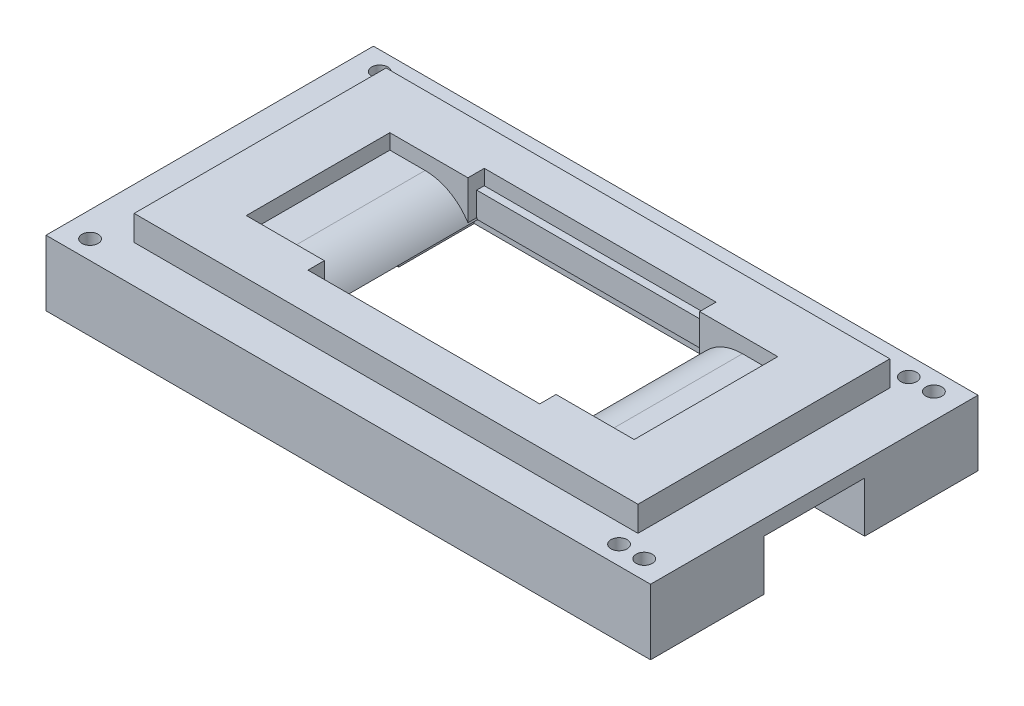
from build123d import *

# Parameters (mm, degrees)
BOSS_EXTRUDE3_DEPTH = 2
SKETCH1_6_W         = 100
SKETCH1_6_H         = 50
BOSS_EXTRUDE4_DEPTH = 5
SKETCH2_W           = 120
SKETCH2_H           = 65
SKETCH2_R           = 1.6
BOSS_EXTRUDE5_DEPTH = 13
SKETCH2_2_W         = 120
SKETCH2_2_H         = 65
SKETCH2_2_R         = 1.6
BOSS_EXTRUDE6_DEPTH = 3
CUT_EXTRUDE1_REACH  = 71.866
SKETCH7_W           = 43
SKETCH7_H           = 32
FILLET1_R           = 10
SKETCH8_W           = 38.5
SKETCH8_H           = 20
CUT_EXTRUDE2_DEPTH  = 10
SKETCH9_W           = 65
SKETCH9_H           = 50
CUT_EXTRUDE3_DEPTH  = 10


with BuildPart() as part:
    # Sketch1 → Boss-Extrude3 (new body)
    with BuildSketch(Plane(origin=(0, 0, 0), x_dir=(1, 0, 0), z_dir=(0, 1, 0))):
        Polygon((23, -14.25), (23, -17.5), (-23, -17.5), (-23, -14.25), (-38.5, -14.25), (-38.5, 14.25), (-23, 14.25), (-23, 17.5), (23, 17.5), (23, 14.25), (38.5, 14.25), (38.5, -14.25), align=None)
    extrude(amount=BOSS_EXTRUDE3_DEPTH)

    # Sketch1<6> → Boss-Extrude4 (add)
    with BuildSketch(Plane(origin=(0, 0, 0), x_dir=(1, 0, 0), z_dir=(0, 1, 0))):
        Rectangle(SKETCH1_6_W, SKETCH1_6_H)
        Polygon((23, -14.25), (23, -17.5), (-23, -17.5), (-23, -14.25), (-38.5, -14.25), (-38.5, 14.25), (-23, 14.25), (-23, 17.5), (23, 17.5), (23, 14.25), (38.5, 14.25), (38.5, -14.25), align=None, mode=Mode.SUBTRACT)
    extrude(amount=BOSS_EXTRUDE4_DEPTH)

    # Sketch2 → Boss-Extrude5 (add)
    with BuildSketch(Plane.XZ):
        Rectangle(SKETCH2_W, SKETCH2_H)
        with Locations(Location((-55, 28.75, 0), (0, 0, 90))):
            Circle(SKETCH2_R, mode=Mode.SUBTRACT)
        with Locations(Location((55, 28.75, 0), (0, 0, 90))):
            Circle(SKETCH2_R, mode=Mode.SUBTRACT)
        with Locations(Location((55, -28.75, 0), (0, 0, 90))):
            Circle(SKETCH2_R, mode=Mode.SUBTRACT)
        with Locations(Location((-55, -28.75, 0), (0, 0, 90))):
            Circle(SKETCH2_R, mode=Mode.SUBTRACT)
        with Locations(Location((50, 28.75, 0), (0, 0, 90))):
            Circle(SKETCH2_R, mode=Mode.SUBTRACT)
        with Locations(Location((50, -28.75, 0), (0, 0, 90))):
            Circle(SKETCH2_R, mode=Mode.SUBTRACT)
    extrude(amount=BOSS_EXTRUDE5_DEPTH)

    # Sketch2<2> → Boss-Extrude6 (add)
    with BuildSketch(Plane.XZ):
        Rectangle(SKETCH2_2_W, SKETCH2_2_H)
        with Locations(Location((-55, 28.75, 0), (0, 0, 90))):
            Circle(SKETCH2_2_R, mode=Mode.SUBTRACT)
        with Locations(Location((55, 28.75, 0), (0, 0, 90))):
            Circle(SKETCH2_2_R, mode=Mode.SUBTRACT)
        with Locations(Location((55, -28.75, 0), (0, 0, 90))):
            Circle(SKETCH2_2_R, mode=Mode.SUBTRACT)
        with Locations(Location((-55, -28.75, 0), (0, 0, 90))):
            Circle(SKETCH2_2_R, mode=Mode.SUBTRACT)
        with Locations(Location((50, 28.75, 0), (0, 0, 90))):
            Circle(SKETCH2_2_R, mode=Mode.SUBTRACT)
        with Locations(Location((50, -28.75, 0), (0, 0, 90))):
            Circle(SKETCH2_2_R, mode=Mode.SUBTRACT)
    extrude(amount=BOSS_EXTRUDE6_DEPTH)

    # Sketch7 → Cut-Extrude1 (cut, up to next)
    with BuildSketch(Plane(origin=(0, 2, 0), x_dir=(1, 0, 0), z_dir=(0, 1, 0)), mode=Mode.PRIVATE) as cut_extrude1_sk1:
        Rectangle(SKETCH7_W, SKETCH7_H)
    cut_extrude1_tool1 = extrude(cut_extrude1_sk1.sketch, amount=-CUT_EXTRUDE1_REACH, mode=Mode.PRIVATE) & part.part
    add(cut_extrude1_tool1.solids().sort_by_distance((0, 2, 0))[0], mode=Mode.SUBTRACT)

    # Fillet1
    # the kernel refuses this fillet: 10 mm, written as the material it takes off along each edge
    with BuildSketch(Plane(origin=(-21.5, 2, 16), x_dir=(0, -1, 0), z_dir=(0, 0, -1))) as fillet1_piece_1_section:
        with BuildLine():
            CenterArc((FILLET1_R, FILLET1_R), FILLET1_R, 180, 90)
            Line((0, FILLET1_R), (0, 0))
            Line((0, 0), (FILLET1_R, 0))
        make_face()
    fillet1_piece_1 = extrude(amount=32, mode=Mode.PRIVATE)
    fillet1_piece_1 = split(fillet1_piece_1, bisect_by=Plane(origin=(-23, -2.387167078, 15.125), z_dir=(1, 0, 0)), keep=Keep.TOP, mode=Mode.PRIVATE)
    add(fillet1_piece_1, mode=Mode.SUBTRACT)
    with BuildSketch(Plane(origin=(-21.5, 2, 41), x_dir=(0, -1, 0), z_dir=(0, 0, -1))) as fillet1_piece_2_section:
        with BuildLine():
            CenterArc((FILLET1_R, FILLET1_R), FILLET1_R, 180, 90)
            Line((0, FILLET1_R), (0, 0))
            Line((0, 0), (FILLET1_R, 0))
        make_face()
    fillet1_piece_2 = extrude(amount=82, mode=Mode.PRIVATE)
    fillet1_piece_2 = split(fillet1_piece_2, bisect_by=Plane(origin=(-23.780995079, -0.852225246, -14.25), z_dir=(0, 0, 1)), keep=Keep.TOP, mode=Mode.PRIVATE)
    fillet1_piece_2 = split(fillet1_piece_2, bisect_by=Plane(origin=(-23.780995079, -0.852225246, 14.25), z_dir=(0, 0, -1)), keep=Keep.TOP, mode=Mode.PRIVATE)
    add(fillet1_piece_2, mode=Mode.SUBTRACT)
    with BuildSketch(Plane(origin=(21.5, 2, -16), x_dir=(0, -1, 0), z_dir=(0, 0, 1))) as fillet1_piece_3_section:
        with BuildLine():
            CenterArc((FILLET1_R, FILLET1_R), FILLET1_R, 180, 90)
            Line((0, FILLET1_R), (0, 0))
            Line((0, 0), (FILLET1_R, 0))
        make_face()
    fillet1_piece_3 = extrude(amount=32, mode=Mode.PRIVATE)
    fillet1_piece_3 = split(fillet1_piece_3, bisect_by=Plane(origin=(23, -2.387167078, -15.125), z_dir=(-1, 0, 0)), keep=Keep.TOP, mode=Mode.PRIVATE)
    add(fillet1_piece_3, mode=Mode.SUBTRACT)
    with BuildSketch(Plane(origin=(21.5, 2, -41), x_dir=(0, -1, 0), z_dir=(0, 0, 1))) as fillet1_piece_4_section:
        with BuildLine():
            CenterArc((FILLET1_R, FILLET1_R), FILLET1_R, 180, 90)
            Line((0, FILLET1_R), (0, 0))
            Line((0, 0), (FILLET1_R, 0))
        make_face()
    fillet1_piece_4 = extrude(amount=82, mode=Mode.PRIVATE)
    fillet1_piece_4 = split(fillet1_piece_4, bisect_by=Plane(origin=(23.780995079, -0.852225246, 14.25), z_dir=(0, 0, -1)), keep=Keep.TOP, mode=Mode.PRIVATE)
    fillet1_piece_4 = split(fillet1_piece_4, bisect_by=Plane(origin=(23.780995079, -0.852225246, -14.25), z_dir=(0, 0, 1)), keep=Keep.TOP, mode=Mode.PRIVATE)
    add(fillet1_piece_4, mode=Mode.SUBTRACT)

    # Sketch8 → Cut-Extrude2 (cut)
    with BuildSketch(Plane.XZ.offset(13)):
        with Locations((-40.75, 0)):
            Rectangle(SKETCH8_W, SKETCH8_H)
        with Locations((40.75, 0)):
            Rectangle(SKETCH8_W, SKETCH8_H)
    extrude(amount=-CUT_EXTRUDE2_DEPTH, mode=Mode.SUBTRACT)

    # Sketch9 → Cut-Extrude3 (cut)
    with BuildSketch(Plane(origin=(0, -13, 0), x_dir=(-1, 0, 0), z_dir=(0, -1, 0))):
        Rectangle(SKETCH9_W, SKETCH9_H)
    extrude(amount=-CUT_EXTRUDE3_DEPTH, mode=Mode.SUBTRACT)


solid = part.part
